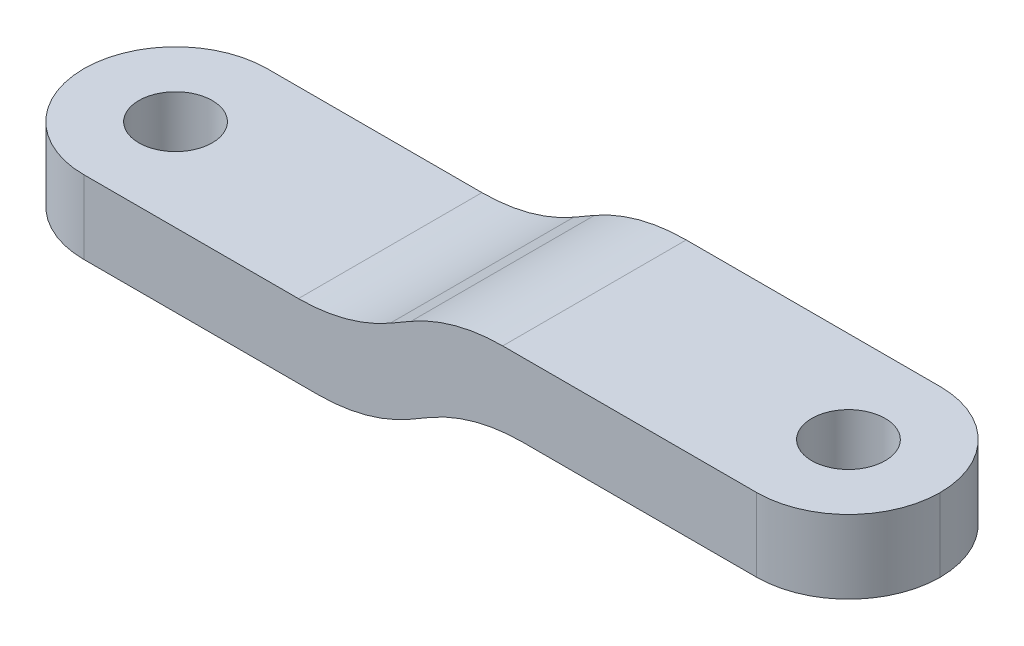
from build123d import *

# Parameters (mm, degrees)
SALIENTE_EXTRUIR1_DEPTH    = 7.5
REDONDEO1_R                = 15
REDONDEO2_R                = 7.5
CORTAR_EXTRUIR1_DEPTH      = 41.485909788
CORTAR_EXTRUIR1_DEPTH_BACK = 41.485909788
CROQUIS2_R                 = 3


with BuildPart() as part:
    # Croquis1 → Saliente-Extruir1 (new, symmetric)
    with BuildSketch(Plane.XY):
        Polygon((0, 0), (-30.669872981, 0), (-30.669872981, 6), (-1.607695155, 6), (7.052558883, 11), (39.330127019, 11), (39.330127019, 5), (8.660254038, 5), align=None)
    extrude(amount=SALIENTE_EXTRUIR1_DEPTH, both=True)

    # Redondeo1
    redondeo1_edges = [part.edges().sort_by_distance(p)[0] for p in [
        (0, 0, 0),
        (-1.607695155, 6, 0),
        (7.052558883, 11, 0),
        (8.660254038, 5, 0),
    ]]
    fillet(redondeo1_edges, radius=REDONDEO1_R)

    # Redondeo2
    redondeo2_edges = [part.edges().sort_by_distance(p)[0] for p in [
        (-30.669872981, 3, -7.5),
        (-30.669872981, 3, 7.5),
        (39.330127019, 8, -7.5),
        (39.330127019, 8, 7.5),
    ]]
    fillet(redondeo2_edges, radius=REDONDEO2_R - 0.0001)  # a hair under: the kernel refuses the full size

    # Croquis2 → Cortar-Extruir1 (cut, two sides: drawn at the far end of the back side and taken through both)
    with BuildSketch(Plane(origin=(0, 6, 0), x_dir=(1, 0, 0), z_dir=(0, 1, 0)).offset(-CORTAR_EXTRUIR1_DEPTH_BACK)):
        with Locations(Location((-23.169872981, 0, 0), (0, 0, 270))):
            Circle(CROQUIS2_R)
        with Locations(Location((31.830127019, 0, 0), (0, 0, 270))):
            Circle(CROQUIS2_R)
    extrude(amount=CORTAR_EXTRUIR1_DEPTH + CORTAR_EXTRUIR1_DEPTH_BACK, mode=Mode.SUBTRACT)


solid = part.part
